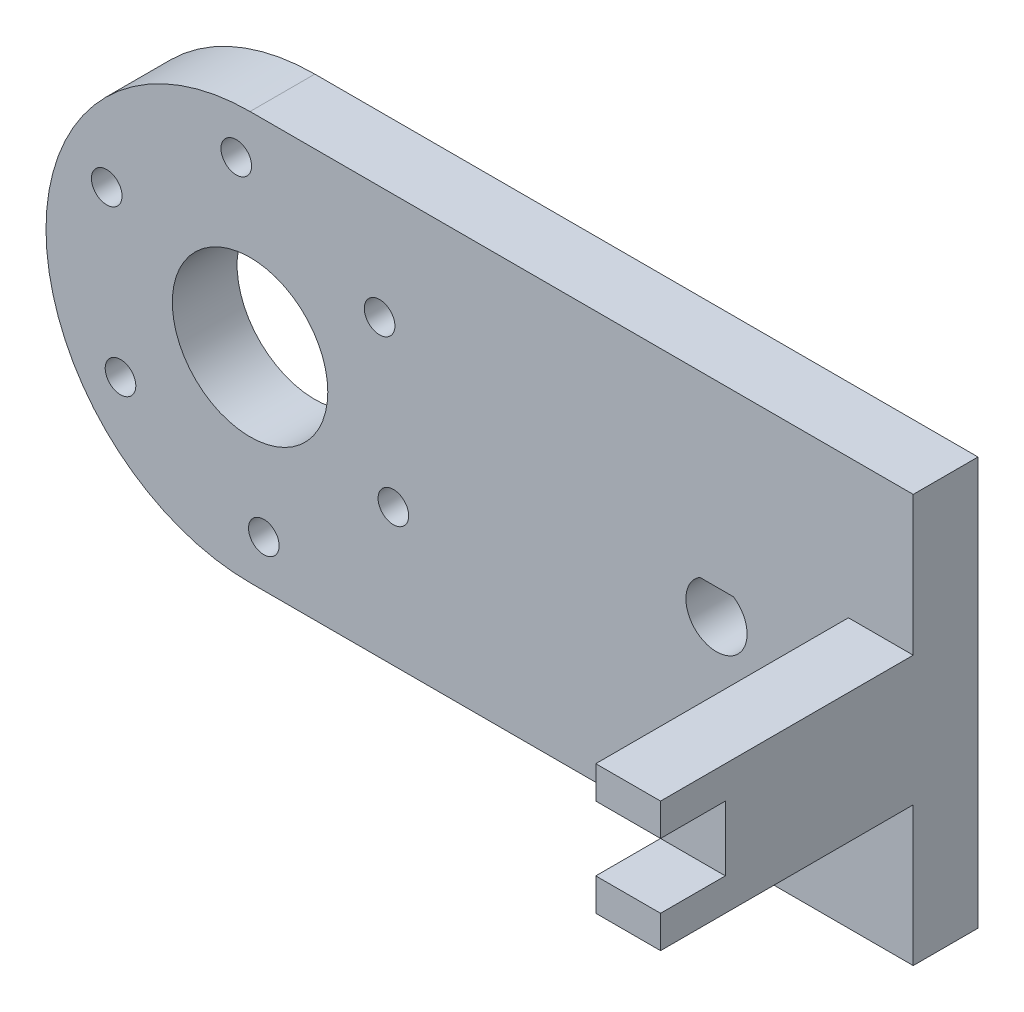
from build123d import *

# Parameters (mm, degrees)
SKETCH1_R           = 20
SKETCH1_W           = 65
SKETCH1_H           = 40
BOSS_EXTRUDE1_DEPTH = 6.35
SKETCH2_R           = 7.62
SKETCH2_R_2         = 1.5
CUT_EXTRUDE1_DEPTH  = 69.303166105
SKETCH4_W           = 6.35
SKETCH4_H           = 24.765
BOSS_EXTRUDE2_DEPTH = 6.35
CUT_EXTRUDE2_REACH  = 94.699
SKETCH5_W           = 6.35
SKETCH5_H           = 6.35
CUT_EXTRUDE3_REACH  = 76.787
SKETCH7_R           = 17.5
SKETCH7_R_2         = 13.5
CUT_EXTRUDE4_DEPTH  = 2


with BuildPart() as part:
    # Sketch1 → Boss-Extrude1 (new body)
    with BuildSketch(Plane.XY):
        Circle(SKETCH1_R)
        with Locations((32.5, 0)):
            Rectangle(SKETCH1_W, SKETCH1_H)
    extrude(amount=BOSS_EXTRUDE1_DEPTH)

    # Sketch2 → Cut-Extrude1 (cut, through all)
    with BuildSketch(Plane.XY.offset(6.35)):
        Circle(SKETCH2_R)
        with Locations((-1.350914013, 15.44101782)):
            Circle(SKETCH2_R_2)
        with Locations((12.696856686, 8.890434763)):
            Circle(SKETCH2_R_2)
        with Locations((14.047770699, -6.550583057)):
            Circle(SKETCH2_R_2)
        with Locations((1.350914013, -15.44101782)):
            Circle(SKETCH2_R_2)
        with Locations((-12.696856686, -8.890434763)):
            Circle(SKETCH2_R_2)
        with Locations((-14.047770699, 6.550583057)):
            Circle(SKETCH2_R_2)
    extrude(amount=-CUT_EXTRUDE1_DEPTH, mode=Mode.SUBTRACT)

    # Sketch4 → Boss-Extrude2 (add, symmetric)
    with BuildSketch(Plane(origin=(0, 0, 0), x_dir=(1, 0, 0), z_dir=(0, 1, 0))):
        with Locations((61.825, -18.7325)):
            Rectangle(SKETCH4_W, SKETCH4_H)
    extrude(amount=BOSS_EXTRUDE2_DEPTH, both=True)

    # Sketch5 → Cut-Extrude2 (cut, up to next)
    with BuildSketch(Plane(origin=(65, 0, 0), x_dir=(0, 0, -1), z_dir=(1, 0, 0)), mode=Mode.PRIVATE) as cut_extrude2_sk1:
        with Locations((-27.94, 0)):
            Rectangle(SKETCH5_W, SKETCH5_H)
    cut_extrude2_tool1 = extrude(cut_extrude2_sk1.sketch, amount=-CUT_EXTRUDE2_REACH, mode=Mode.PRIVATE) & part.part
    add(cut_extrude2_tool1.solids().sort_by_distance((65, 0, 27.94))[0], mode=Mode.SUBTRACT)

    # Sketch6 → Cut-Extrude3 (cut, up to next)
    with BuildSketch(Plane(origin=(0, 0, 0), x_dir=(-1, 0, 0), z_dir=(0, 0, -1)), mode=Mode.PRIVATE) as cut_extrude3_sk1:
        with BuildLine():
            Line((-47.378312395, 2.5), (-44.061687605, 2.5))
            ThreePointArc((-44.061687605, 2.5), (-45.72, -3), (-47.378312395, 2.5))
        make_face()
    cut_extrude3_tool1 = extrude(cut_extrude3_sk1.sketch, amount=-CUT_EXTRUDE3_REACH, mode=Mode.PRIVATE) & part.part
    add(cut_extrude3_tool1.solids().sort_by_distance((45.72, -0.111984, 0))[0], mode=Mode.SUBTRACT)

    # Sketch7 → Cut-Extrude4 (cut)
    with BuildSketch(Plane(origin=(0, 0, 0), x_dir=(-1, 0, 0), z_dir=(0, 0, -1))):
        with Locations((-45.72, 0)):
            Circle(SKETCH7_R)
        with Locations((-45.72, 0)):
            Circle(SKETCH7_R_2, mode=Mode.SUBTRACT)
    extrude(amount=-CUT_EXTRUDE4_DEPTH, mode=Mode.SUBTRACT)


solid = part.part
